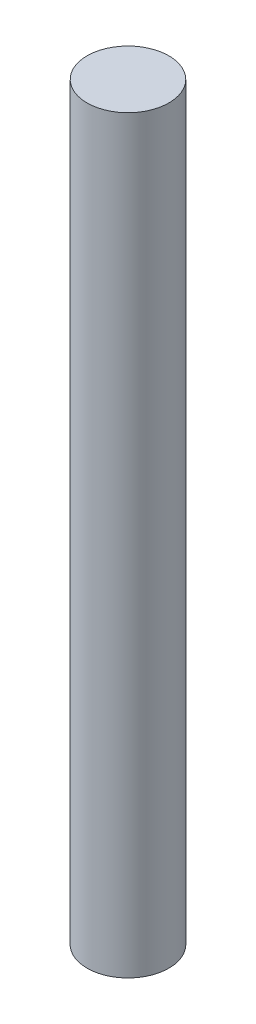
from build123d import *

# Parameters (mm, degrees)
SKETCH1_R           = 3
BOSS_EXTRUDE1_DEPTH = 55


with BuildPart() as part:
    # Sketch1 → Boss-Extrude1 (new body)
    with BuildSketch(Plane(origin=(0, 0, 0), x_dir=(1, 0, 0), z_dir=(0, 1, 0))):
        Circle(SKETCH1_R)
    extrude(amount=BOSS_EXTRUDE1_DEPTH)


solid = part.part
